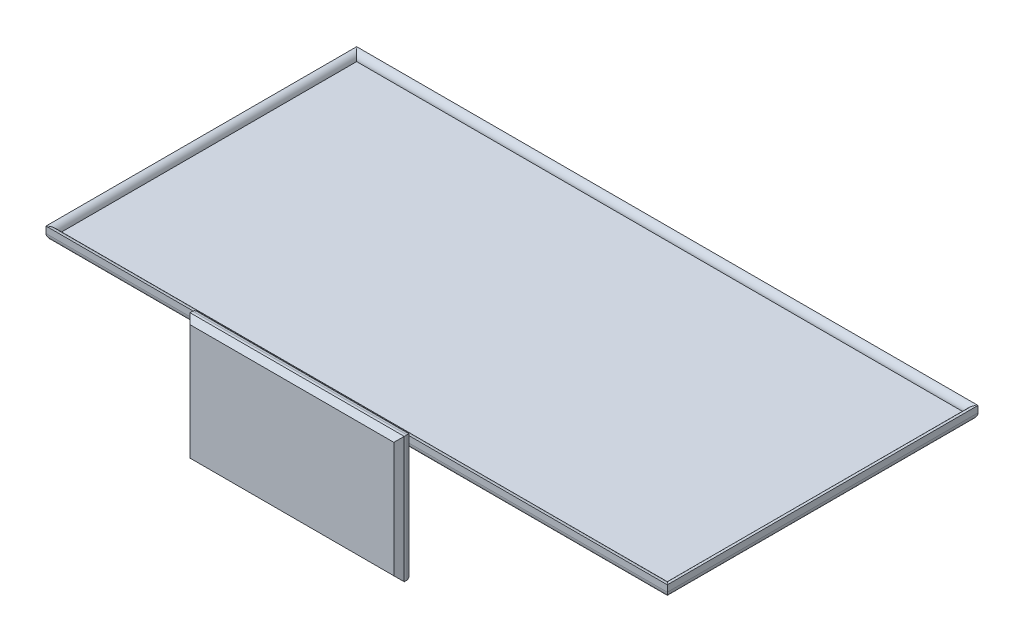
from build123d import *

# Parameters (mm, degrees)
SKETCH1_W           = 12
SKETCH1_H           = 6
BOSS_EXTRUDE1_DEPTH = 0.25
CUT_EXTRUDE1_DEPTH  = 0.125
SKETCH2_W           = 0.3
SKETCH2_H           = 0.25
BOSS_EXTRUDE2_DEPTH = 1
SKETCH4_W           = 4.136186254
SKETCH4_H           = 2.43263025
BOSS_EXTRUDE3_DEPTH = 0.25
FILLET2_R           = 0.1
CHAMFER1_SIZE       = 0.1
FILLET3_R           = 0.125
CHAMFER2_SIZE       = 0.1
FILLET4_R           = 0.125


with BuildPart() as part:
    # Sketch1 → Boss-Extrude1 (new body)
    with BuildSketch(Plane(origin=(0, 0, 0), x_dir=(1, 0, 0), z_dir=(0, 1, 0))):
        Rectangle(SKETCH1_W, SKETCH1_H)
    extrude(amount=BOSS_EXTRUDE1_DEPTH)

    # 3DSketch1 → Cut-Extrude1 (cut)
    with BuildSketch(Plane(origin=(-5.875, 0.25, -2.875), x_dir=(0.8982167220477767, 0, 0.43955286398082694), z_dir=(0, -1, 0))):
        Polygon((0, 0), (2.527428968, 5.164746152), (13.081475452, 0), (10.554046484, -5.164746152), align=None)
    extrude(amount=CUT_EXTRUDE1_DEPTH, mode=Mode.SUBTRACT)

    # Sketch2 → Boss-Extrude2 (add)
    with BuildSketch(Plane.XY.offset(3)):
        with Locations((-0.001421044, 0.125)):
            Rectangle(SKETCH2_W, SKETCH2_H)
    extrude(amount=BOSS_EXTRUDE2_DEPTH)

    # Sketch4 → Boss-Extrude3 (add)
    with BuildSketch(Plane.XY.offset(4)):
        with Locations((0, 0.125)):
            Rectangle(SKETCH4_W, SKETCH4_H)
    extrude(amount=BOSS_EXTRUDE3_DEPTH)

    # Fillet2
    fillet2_edges = [part.edges().sort_by_distance(p)[0] for p in [
        (2.068093127, 0.125, 4),
        (0, 1.341315125, 4),
        (-2.068093127, 0.125, 4),
        (0, -1.091315125, 4),
    ]]
    fillet(fillet2_edges, radius=FILLET2_R)

    # Chamfer1
    chamfer1_edges = [part.edges().sort_by_distance(p)[0] for p in [
        (2.068093127, 0.125, 4.25),
        (0, 1.341315125, 4.25),
        (-2.068093127, 0.125, 4.25),
        (0, -1.091315125, 4.25),
    ]]
    chamfer(chamfer1_edges, length=CHAMFER1_SIZE)

    # Fillet3
    fillet3_edges = [part.edges().sort_by_distance(p)[0] for p in [
        (0, 0.25, 2.875),
        (-5.875, 0.25, 0),
        (0, 0.25, -2.875),
        (5.875, 0.25, 0),
    ]]
    fillet(fillet3_edges, radius=FILLET3_R - 0.0001)  # a hair under: the kernel refuses the full size

    # Chamfer2
    chamfer2_edges = [part.edges().sort_by_distance(p)[0] for p in [
        (0.148578956, 0, 3.5),
        (0.148578956, 0.25, 3.5),
        (-0.151421044, 0.25, 3.5),
        (-0.151421044, 0, 3.5),
    ]]
    chamfer(chamfer2_edges, length=CHAMFER2_SIZE)

    # Fillet4
    fillet4_edges = [part.edges().sort_by_distance(p)[0] for p in [
        (6, 0, 0),
        (3.024289478, 0, 3),
        (-3.025710522, 0, 3),
        (-6, 0, 0),
        (0, 0, -3),
    ]]
    fillet(fillet4_edges, radius=FILLET4_R)


solid = part.part
